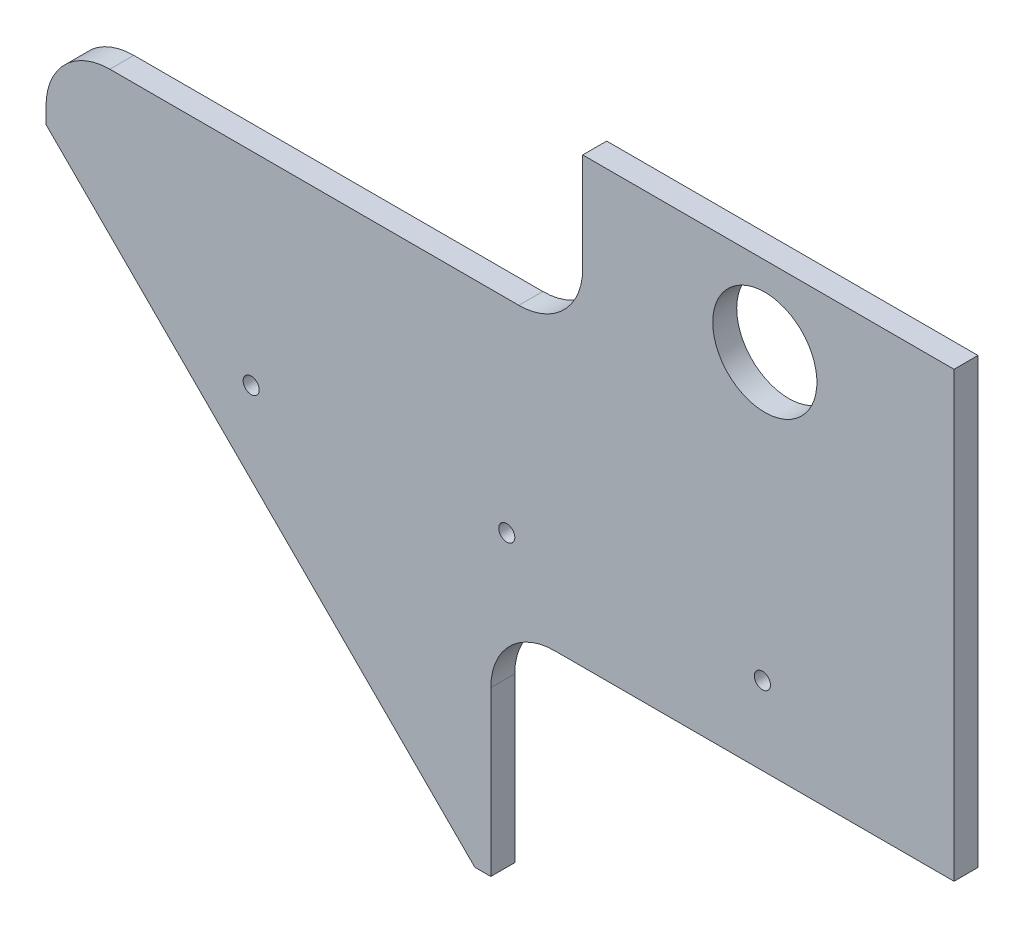
from build123d import *

# Parameters (mm, degrees)
SKETCH1_R                  = 20.701
BOSS_EXTRUDE1_DEPTH        = 9.525
SKETCH2_W                  = 184.15
SKETCH2_H                  = 90.42146
CUT_EXTRUDE1_DEPTH         = 267.045158533
FILLET1_R                  = 25.4
SKETCH4_W                  = 213.36
SKETCH4_H                  = 64.479988722
CUT_EXTRUDE2_DEPTH         = 267.045158533
FILLET2_R                  = 25.4
F_6_4_6_4_DIAMETER_HOLE2_D = 6.4
F_6_4_6_4_DIAMETER_HOLE3_D = 6.4
F_6_4_6_4_DIAMETER_HOLE4_D = 6.4


with BuildPart() as part:
    # Sketch1 → Boss-Extrude1 (new body)
    with BuildSketch(Plane.XY):
        Polygon((-138.259383474, 48.991487021), (32.210627804, -121.478524257), (222.710627804, -121.478524257), (222.710627804, 145.221475743), (-138.259383474, 145.221475743), align=None)
        with Locations((147.490616526, 113.471475743)):
            Circle(SKETCH1_R, mode=Mode.SUBTRACT)
    extrude(amount=BOSS_EXTRUDE1_DEPTH)

    # Sketch2 → Cut-Extrude1 (cut, through all)
    with BuildSketch(Plane.XY.offset(9.525)):
        with Locations((130.635627804, -76.267794257)):
            Rectangle(SKETCH2_W, SKETCH2_H)
    extrude(amount=-CUT_EXTRUDE1_DEPTH, mode=Mode.SUBTRACT)

    # Fillet1
    fillet1_edges = [part.edges().sort_by_distance(p)[0] for p in [
        (38.560627804, -31.057064257, 4.7625),
    ]]
    fillet(fillet1_edges, radius=FILLET1_R)

    # Sketch4 → Cut-Extrude2 (cut, through all)
    with BuildSketch(Plane.XY.offset(9.525)):
        with Locations((-31.579383474, 112.981481382)):
            Rectangle(SKETCH4_W, SKETCH4_H)
    extrude(amount=-CUT_EXTRUDE2_DEPTH, mode=Mode.SUBTRACT)

    # Fillet2
    fillet2_edges = [part.edges().sort_by_distance(p)[0] for p in [
        (-138.259383474, 80.741487021, 4.7625),
        (75.100616526, 80.741487021, 4.7625),
    ]]
    fillet(fillet2_edges, radius=FILLET2_R)

    # Ø6.4 (6.4) Diameter Hole2 (through all)
    with Locations(Plane(origin=(0, 0, 0), x_dir=(-1, 0, 0), z_dir=(0, 0, -1))):
        with Locations((-146.510627804, 0)):
            Hole(F_6_4_6_4_DIAMETER_HOLE2_D / 2)

    # Ø6.4 (6.4) Diameter Hole3 (through all)
    with Locations(Plane(origin=(0, 0, 0), x_dir=(-1, 0, 0), z_dir=(0, 0, -1))):
        with Locations((-44.910627804, 0)):
            Hole(F_6_4_6_4_DIAMETER_HOLE3_D / 2)

    # Ø6.4 (6.4) Diameter Hole4 (through all)
    with Locations(Plane(origin=(0, 0, 0), x_dir=(-1, 0, 0), z_dir=(0, 0, -1))):
        with Locations((56.689372196, 0)):
            Hole(F_6_4_6_4_DIAMETER_HOLE4_D / 2)


solid = part.part
